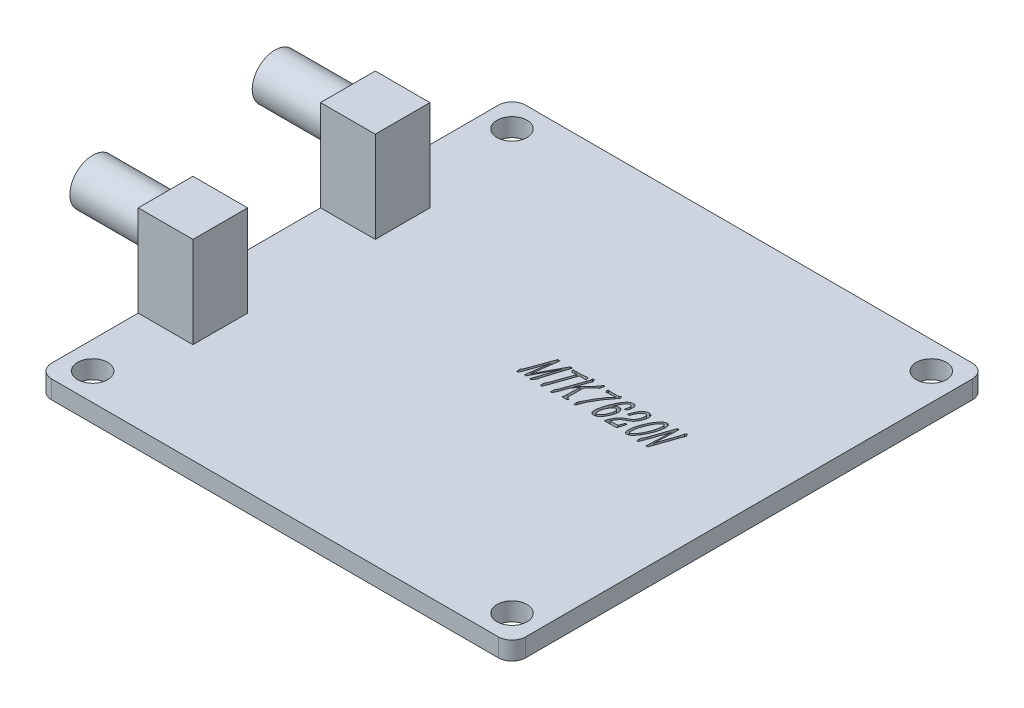
from build123d import *

# Parameters (mm, degrees)
SKETCH_1_R          = 1.65
EXTRUDE_1_DEPTH     = 2
CUT_EXTRUDE_START   = -1
CUT_EXTRUDE_1_DEPTH = 1
SKETCH_3_W          = 6
SKETCH_3_H          = 6
EXTRUDE_2_DEPTH     = 10
SKETCH_4_R          = 2.5
EXTRUDE_3_DEPTH     = 8


# Read off the part's stored shape, not the designer's step: 切除-拉伸1
with BuildPart() as part:
    # 草图1 → 凸台-拉伸1 (new body)
    with BuildSketch(Plane(origin=(0, 0, 0), x_dir=(1, 0, 0), z_dir=(0, 1, 0))):
        with BuildLine():
            Line((24.5, -26), (-24.5, -26))
            ThreePointArc((-24.5, -26), (-25.560660172, -25.560660172), (-26, -24.5))
            Line((-26, -24.5), (-26, 24.5))
            ThreePointArc((-26, 24.5), (-25.560660172, 25.560660172), (-24.5, 26))
            Line((-24.5, 26), (24.5, 26))
            ThreePointArc((24.5, 26), (25.560660172, 25.560660172), (26, 24.5))
            Line((26, 24.5), (26, -24.5))
            ThreePointArc((26, -24.5), (25.560660172, -25.560660172), (24.5, -26))
        make_face()
        with Locations(Location((-23, 23, 0), (0, 0, 270))):
            Circle(SKETCH_1_R, mode=Mode.SUBTRACT)
        with Locations(Location((23, 23, 0), (0, 0, 90))):
            Circle(SKETCH_1_R, mode=Mode.SUBTRACT)
        with Locations(Location((-23, -23, 0), (0, 0, 90))):
            Circle(SKETCH_1_R, mode=Mode.SUBTRACT)
        with Locations(Location((23, -23, 0), (0, 0, 270))):
            Circle(SKETCH_1_R, mode=Mode.SUBTRACT)
    extrude(amount=EXTRUDE_1_DEPTH)

    # 切除-拉伸1 outline → 切除-拉伸1 (cut)
    # profile 1 of 8: a face of its own
    with BuildSketch(Plane(origin=(0, 2, 0), x_dir=(1, 0, 0), z_dir=(0, 1, 0)).offset(CUT_EXTRUDE_START)):
        with BuildLine():
            add(Edge.make_bspline(
                [(2.232154272, 1.011293416), (2.227540815, 0.998411394), (2.218976214, 0.974496709), (2.209064178, 0.940605878), (2.199435252, 0.912364054), (2.191731413, 0.881013608), (2.185728639, 0.845126386), (2.180165157, 0.804614334), (2.17867756, 0.766926656), (2.18024684, 0.734019354), (2.183350071, 0.705928575), (2.183374478, 0.681837677), (2.172770566, 0.65791386), (2.154886953, 0.628493151), (2.127376264, 0.586082516), (2.104768227, 0.554268415), (2.091945451, 0.536224164)],
                knots=[0, 0, 0, 0, 0.080753431, 0.149913804, 0.20839393, 0.25679974, 0.340280675, 0.42310116, 0.498002039, 0.562639444, 0.617115751, 0.66563266, 0.701877649, 0.769590465, 0.869316836, 1, 1, 1, 1], degree=3))
            Line((2.232154272, 1.011293416), (2.301512892, 1.229064564))
            Line((2.301512892, 1.229064564), (3.050287662, 3.593969742))
            Line((3.050287662, 3.593969742), (2.804922225, 3.593969742))
            Line((2.804922225, 3.593969742), (1.287982101, 0.797251225))
            Line((1.287982101, 0.797251225), (1.672810569, 3.593969742))
            Line((1.672810569, 3.593969742), (1.423716173, 3.593969742))
            Line((1.423716173, 3.593969742), (0.560089495, 1.20370765))
            add(Edge.make_bspline(
                [(0.272213936, 0.566055828), (0.27409731, 0.581109529), (0.277792716, 0.610646704), (0.294162379, 0.653578281), (0.318048076, 0.696107861), (0.348164727, 0.736707605), (0.373619365, 0.773152741), (0.393785138, 0.796774711), (0.403682463, 0.815674908), (0.413957842, 0.833170877), (0.423465977, 0.858589935), (0.436626196, 0.887240928), (0.447811248, 0.917106232), (0.459447685, 0.942058714), (0.46745311, 0.961643085), (0.473464246, 0.975295176), (0.479086979, 0.986958971), (0.483591552, 1.001370544), (0.492766441, 1.020673065), (0.501601802, 1.046375699), (0.513117106, 1.077755243), (0.527308709, 1.114356101), (0.542869419, 1.157244706), (0.554103428, 1.187556135), (0.560089495, 1.20370765)],
                knots=[0, 0, 0, 0, 0.064362733, 0.126287432, 0.194015174, 0.271510944, 0.341137925, 0.383462597, 0.40288704, 0.431768008, 0.469698212, 0.518048477, 0.565991795, 0.60531333, 0.635185225, 0.656027709, 0.668812983, 0.690238215, 0.72011011, 0.759616287, 0.805811297, 0.862408184, 0.926683881, 1, 1, 1, 1], degree=3))
            Line((0.272213936, 0.566055828), (0.284146601, 0.348284679))
            add(Edge.make_bspline(
                [(0.330385681, 0.198380567), (0.324328283, 0.199225064), (0.311143825, 0.201063186), (0.295355682, 0.211024146), (0.286852067, 0.226009088), (0.282546334, 0.242607416), (0.280767995, 0.263963083), (0.28077226, 0.288405989), (0.282850781, 0.311719688), (0.282995494, 0.330155913), (0.284222271, 0.341561625), (0.284163396, 0.346792507), (0.284146601, 0.348284679)],
                knots=[0, 0, 0, 0, 0.103457675, 0.225184737, 0.299006802, 0.391175757, 0.514212532, 0.661916962, 0.805649294, 0.911236827, 0.974679241, 1, 1, 1, 1], degree=3))
            add(Edge.make_bspline(
                [(0.53920733, 0.401981675), (0.529908782, 0.378448997), (0.510794992, 0.330075993), (0.480593337, 0.272172839), (0.447684759, 0.230566669), (0.414261894, 0.209155613), (0.374156185, 0.197425234), (0.345631365, 0.198047815), (0.330385681, 0.198380567)],
                knots=[0, 0, 0, 0, 0.238225779, 0.489689114, 0.612577651, 0.732692637, 0.85713202, 1, 1, 1, 1], degree=3))
            Line((0.53920733, 0.401981675), (0.654059237, 0.707756233))
            Line((0.654059237, 0.707756233), (1.405817175, 2.796718517))
            Line((1.405817175, 2.796718517), (1.024717665, 0.322927765))
            Line((1.024717665, 0.322927765), (1.238014063, 0.31621564))
            Line((1.238014063, 0.31621564), (2.545386746, 2.826550181))
            Line((2.545386746, 2.826550181), (1.864479011, 0.733113147))
            Line((1.864479011, 0.733113147), (1.768271894, 0.427338589))
            add(Edge.make_bspline(
                [(1.717558065, 0.252077562), (1.7166954, 0.259799804), (1.714416729, 0.280197582), (1.724508183, 0.317902753), (1.742753226, 0.368247272), (1.759070895, 0.406032651), (1.768271894, 0.427338589)],
                knots=[0, 0, 0, 0, 0.125565402, 0.331672527, 0.62315202, 1, 1, 1, 1], degree=3))
            add(Edge.make_bspline(
                [(1.978585127, 0.367675261), (1.967074159, 0.352371298), (1.94570541, 0.323961301), (1.913841208, 0.286856075), (1.885730179, 0.257719643), (1.853151043, 0.232438728), (1.812850107, 0.213403669), (1.771434856, 0.211295154), (1.743782575, 0.218107417), (1.72784141, 0.225191195), (1.718360869, 0.237650105), (1.717828641, 0.24721496), (1.717558065, 0.252077562)],
                knots=[0, 0, 0, 0, 0.167159473, 0.310311779, 0.426966479, 0.519877317, 0.66953105, 0.808609623, 0.871260354, 0.917867672, 0.958245383, 1, 1, 1, 1], degree=3))
            Line((1.978585127, 0.367675261), (2.091945451, 0.536224164))
        make_face()
    # profile 2 of 8: a face of its own
    with BuildSketch(Plane(origin=(0, 2, 0), x_dir=(1, 0, 0), z_dir=(0, 1, 0)).offset(CUT_EXTRUDE_START)):
        with BuildLine():
            add(Edge.make_bspline(
                [(10.437353505, 2.1941189), (10.446026344, 2.224704013), (10.462189079, 2.281702542), (10.485152093, 2.361132264), (10.506037645, 2.42793498), (10.530531536, 2.503501881), (10.565128451, 2.594316086), (10.595245953, 2.666295228), (10.611122949, 2.704240358)],
                knots=[0, 0, 0, 0, 0.176806308, 0.329496897, 0.459810584, 0.566052454, 0.77123656, 1, 1, 1, 1], degree=3))
            Line((10.437353505, 2.1941189), (10.612614532, 2.217984232))
            Line((10.612614532, 2.217984232), (10.667057319, 2.241103772))
            Line((10.667057319, 2.241103772), (10.726720648, 2.402194758))
            add(Edge.make_bspline(
                [(11.42030684, 3.241210313), (11.400981482, 3.240757185), (11.358546289, 3.239762191), (11.292894873, 3.21333138), (11.221614317, 3.170582731), (11.146340961, 3.109611004), (11.069477899, 3.032289377), (10.996608177, 2.936860027), (10.925400318, 2.824648378), (10.85501324, 2.696335254), (10.786863893, 2.554061095), (10.747004503, 2.453413057), (10.726720648, 2.402194758)],
                knots=[0, 0, 0, 0, 0.050563255, 0.111028292, 0.18322451, 0.269416453, 0.365243966, 0.469747148, 0.584883573, 0.714985691, 0.85496043, 1, 1, 1, 1], degree=3))
            add(Edge.make_bspline(
                [(11.618687407, 2.843703388), (11.621362482, 2.870021391), (11.626476726, 2.920336507), (11.626930184, 2.99333408), (11.619162222, 3.059541133), (11.60698924, 3.11918998), (11.584267821, 3.172021345), (11.541983264, 3.210604938), (11.485679085, 3.234856875), (11.443198161, 3.238985537), (11.42030684, 3.241210313)],
                knots=[0, 0, 0, 0, 0.154058382, 0.294530913, 0.424229108, 0.541566664, 0.649092709, 0.752563447, 0.866666044, 1, 1, 1, 1], degree=3))
            add(Edge.make_bspline(
                [(11.037715747, 1.891327509), (11.056501812, 1.901021344), (11.092648266, 1.919673349), (11.142415445, 1.950516435), (11.187181456, 1.980772805), (11.226841996, 2.014571505), (11.265966668, 2.053553536), (11.306006158, 2.102337589), (11.347976119, 2.162612276), (11.40891101, 2.254276533), (11.478448462, 2.376167772), (11.543353536, 2.528763989), (11.591845474, 2.683894653), (11.609706104, 2.790231434), (11.618687407, 2.843703388)],
                knots=[0, 0, 0, 0, 0.05476668, 0.105377116, 0.151669174, 0.194650271, 0.240210143, 0.294657526, 0.357948043, 0.430501334, 0.579948825, 0.72081211, 0.859609046, 1, 1, 1, 1], degree=3))
            Line((11.037715747, 1.891327509), (10.791604517, 1.763051353))
            add(Edge.make_bspline(
                [(9.945131046, 0.838269763), (9.972038892, 0.893321497), (10.022825885, 0.99722844), (10.104763407, 1.13827915), (10.184701816, 1.256681798), (10.265184953, 1.351995827), (10.342715012, 1.429631638), (10.413551946, 1.497370541), (10.479464321, 1.554686162), (10.561071679, 1.617984485), (10.663789163, 1.687597609), (10.748570642, 1.737646995), (10.791604517, 1.763051353)],
                knots=[0, 0, 0, 0, 0.143839333, 0.271488367, 0.382722806, 0.478837322, 0.563869028, 0.640256739, 0.708952998, 0.768852387, 0.882672751, 1, 1, 1, 1], degree=3))
            add(Edge.make_bspline(
                [(9.888450884, 0.331131472), (9.877464085, 0.330771559), (9.857630179, 0.330121826), (9.830619446, 0.337515829), (9.810068266, 0.352157542), (9.798900603, 0.376235534), (9.797432968, 0.407793192), (9.801403566, 0.448523238), (9.814558223, 0.499146405), (9.84009596, 0.582842534), (9.88447308, 0.697211517), (9.924450023, 0.790176677), (9.945131046, 0.838269763)],
                knots=[0, 0, 0, 0, 0.055062309, 0.09940116, 0.138686278, 0.177851686, 0.228145004, 0.295993015, 0.383390618, 0.490642207, 0.736497112, 1, 1, 1, 1], degree=3))
            Line((9.888450884, 0.331131472), (10.874387385, 0.355742595))
            add(Edge.make_bspline(
                [(11.183890901, 0.553377371), (11.179880521, 0.539966515), (11.172896474, 0.516611612), (11.164120183, 0.485792342), (11.156772207, 0.465080135), (11.150081852, 0.446252079), (11.132172025, 0.425065122), (11.111851659, 0.396911338), (11.074784794, 0.373587741), (11.02434432, 0.364690038), (10.956268033, 0.35589756), (10.903788393, 0.355798239), (10.874387385, 0.355742595)],
                knots=[0, 0, 0, 0, 0.100483591, 0.174991401, 0.22972114, 0.258544779, 0.317448375, 0.426207677, 0.506394728, 0.62409379, 0.789403632, 1, 1, 1, 1], degree=3))
            Line((11.183890901, 0.553377371), (11.399424675, 1.251438312))
            Line((11.399424675, 1.251438312), (11.192094609, 1.251438312))
            Line((11.192094609, 1.251438312), (11.010121457, 0.786064351))
            add(Edge.make_bspline(
                [(10.931067547, 0.642872363), (10.933882441, 0.643394819), (10.939166161, 0.6443755), (10.947123435, 0.650370967), (10.953033056, 0.666113687), (10.966712564, 0.691825755), (10.98654022, 0.733654665), (11.001499502, 0.766901914), (11.010121457, 0.786064351)],
                knots=[0, 0, 0, 0, 0.050886524, 0.095516957, 0.171388695, 0.345046395, 0.622509892, 1, 1, 1, 1], degree=3))
            Line((10.931067547, 0.642872363), (10.134562114, 0.614532282))
            Line((10.134562114, 0.614532282), (10.198700192, 0.772640102))
            add(Edge.make_bspline(
                [(10.834114639, 1.508736416), (10.80478159, 1.492742657), (10.745651012, 1.460501882), (10.661470353, 1.40457342), (10.581018143, 1.34381028), (10.510570769, 1.273672462), (10.44714398, 1.198981821), (10.387001057, 1.120471794), (10.330779509, 1.03414168), (10.278235775, 0.943454614), (10.232002945, 0.85614754), (10.208984723, 0.798428807), (10.198700192, 0.772640102)],
                knots=[0, 0, 0, 0, 0.100736605, 0.203068347, 0.304619499, 0.404315168, 0.502166149, 0.60010617, 0.702437912, 0.812664409, 0.91629854, 1, 1, 1, 1], degree=3))
            Line((10.834114639, 1.508736416), (11.142872363, 1.668335819))
            add(Edge.make_bspline(
                [(11.732793522, 2.308970808), (11.70992826, 2.265279153), (11.663006964, 2.175620482), (11.578653927, 2.049790865), (11.488162457, 1.933450682), (11.405524682, 1.848915338), (11.333665694, 1.792483145), (11.276005971, 1.750233432), (11.211843083, 1.7087072), (11.166348292, 1.68207724), (11.142872363, 1.668335819)],
                knots=[0, 0, 0, 0, 0.166927441, 0.34254808, 0.512188802, 0.665802747, 0.741285181, 0.821454804, 0.907868257, 1, 1, 1, 1], degree=3))
            add(Edge.make_bspline(
                [(11.51800554, 3.538781163), (11.540208987, 3.537117835), (11.58276574, 3.533929778), (11.643386936, 3.520095975), (11.698343083, 3.500313212), (11.746838835, 3.473041702), (11.789608107, 3.441647552), (11.826430185, 3.406681898), (11.856679647, 3.367773107), (11.881774991, 3.325862973), (11.900254703, 3.278828985), (11.91559691, 3.227832865), (11.923675869, 3.171067425), (11.930833425, 3.090010012), (11.928385267, 2.984777885), (11.910280445, 2.856561809), (11.878846994, 2.722605303), (11.838031171, 2.582902167), (11.791137983, 2.44222348), (11.751839228, 2.352469217), (11.732793522, 2.308970808)],
                knots=[0, 0, 0, 0, 0.044636197, 0.085553007, 0.124390622, 0.161466956, 0.196796398, 0.230676006, 0.263017811, 0.295451868, 0.328347086, 0.364194254, 0.402094164, 0.443159791, 0.527501624, 0.612607545, 0.702668551, 0.803424088, 0.90473166, 1, 1, 1, 1], degree=3))
            add(Edge.make_bspline(
                [(10.611122949, 2.704240358), (10.623431556, 2.733376157), (10.64734111, 2.789972648), (10.684014911, 2.871250639), (10.722726581, 2.945167471), (10.761032711, 3.015645801), (10.806582137, 3.083425056), (10.859904041, 3.153346275), (10.923755985, 3.226019045), (10.994102558, 3.300468462), (11.068323555, 3.37039397), (11.144529341, 3.427121407), (11.218504117, 3.471287233), (11.2915945, 3.498431741), (11.359198981, 3.514994961), (11.418862435, 3.529354022), (11.471052865, 3.537226083), (11.503318784, 3.538294735), (11.51800554, 3.538781163)],
                knots=[0, 0, 0, 0, 0.072714776, 0.141248954, 0.204893109, 0.264509684, 0.325534037, 0.392401429, 0.466539591, 0.547790467, 0.627869174, 0.700563736, 0.765849414, 0.825180425, 0.878964782, 0.925827397, 0.966238217, 1, 1, 1, 1], degree=3))
        make_face()
    # profile 3 of 8: a face of its own
    with BuildSketch(Plane(origin=(0, 2, 0), x_dir=(1, 0, 0), z_dir=(0, 1, 0)).offset(CUT_EXTRUDE_START)):
        with BuildLine():
            add(Edge.make_bspline(
                [(12.240677605, 0.281909227), (12.225555712, 0.283605988), (12.194732457, 0.287064531), (12.151181965, 0.307557413), (12.108361685, 0.335460175), (12.067679498, 0.374854333), (12.031499106, 0.427113873), (12.00337103, 0.493843191), (11.983236618, 0.574308928), (11.970445709, 0.667588663), (11.965370115, 0.770822987), (11.964901142, 0.881148501), (11.972934287, 0.997160658), (11.991821752, 1.15735978), (12.027866943, 1.355495343), (12.079235735, 1.546479776), (12.12509233, 1.69036823), (12.15797235, 1.790950136), (12.189076731, 1.885491807), (12.209801044, 1.946284433), (12.21979544, 1.97560196)],
                knots=[0, 0, 0, 0, 0.024470411, 0.049878525, 0.07688002, 0.107038439, 0.140852434, 0.179044671, 0.223539229, 0.274742525, 0.331155154, 0.390694235, 0.45317899, 0.519196415, 0.651682176, 0.778634178, 0.838942965, 0.896064049, 0.949876403, 1, 1, 1, 1], degree=3))
            add(Edge.make_bspline(
                [(13.559982953, 1.864479011), (13.532349511, 1.797409021), (13.475941669, 1.660499786), (13.397385497, 1.490522996), (13.328737601, 1.35125107), (13.271096754, 1.243908781), (13.208467459, 1.134064169), (13.117903418, 0.986483348), (12.996333173, 0.807804108), (12.86455503, 0.641069456), (12.755488962, 0.521788787), (12.67378593, 0.448538226), (12.594017226, 0.388020195), (12.513983237, 0.344387616), (12.437849728, 0.313089996), (12.367275483, 0.29161974), (12.301970305, 0.279869545), (12.260351497, 0.281254524), (12.240677605, 0.281909227)],
                knots=[0, 0, 0, 0, 0.10085837, 0.205881084, 0.260297513, 0.316744586, 0.375270283, 0.43609767, 0.557481045, 0.675547871, 0.73131235, 0.78198088, 0.827957236, 0.870194962, 0.908326141, 0.942230704, 0.972691508, 1, 1, 1, 1], degree=3))
            add(Edge.make_bspline(
                [(13.490624334, 3.558171745), (13.509939195, 3.554875056), (13.547998376, 3.548379059), (13.602116603, 3.526718805), (13.651643016, 3.495704969), (13.697132076, 3.455719487), (13.737078238, 3.404906534), (13.766519156, 3.340531099), (13.787149682, 3.264192109), (13.801173819, 3.145960021), (13.806193104, 2.988991645), (13.795687453, 2.828330454), (13.77886633, 2.695188766), (13.760070346, 2.587217283), (13.735054468, 2.47144543), (13.695596837, 2.308421025), (13.639732676, 2.104146009), (13.586297755, 1.943561287), (13.559982953, 1.864479011)],
                knots=[0, 0, 0, 0, 0.031229977, 0.061537453, 0.092391519, 0.124181989, 0.157860807, 0.194806212, 0.236426189, 0.283712989, 0.384640134, 0.486892873, 0.540531017, 0.598960327, 0.661890621, 0.729696255, 0.866884999, 1, 1, 1, 1], degree=3))
            add(Edge.make_bspline(
                [(12.21979544, 1.97560196), (12.238855402, 2.023967312), (12.2781202, 2.123603176), (12.345074883, 2.274356786), (12.41814873, 2.432243203), (12.498028309, 2.594259772), (12.584698956, 2.75473921), (12.67984981, 2.907101091), (12.781885099, 3.048766218), (12.872526882, 3.158218866), (12.945038353, 3.23931), (12.997634942, 3.292942945), (13.046865018, 3.341419174), (13.092603706, 3.385073884), (13.136748343, 3.421561824), (13.177948965, 3.452230559), (13.215697521, 3.477967098), (13.261684324, 3.503277533), (13.316079836, 3.526102554), (13.377664958, 3.546989772), (13.435752536, 3.558329301), (13.472934311, 3.558222539), (13.490624334, 3.558171745)],
                knots=[0, 0, 0, 0, 0.073657242, 0.151738852, 0.23369364, 0.320183581, 0.40767494, 0.492027186, 0.574543325, 0.654873965, 0.69328591, 0.728660531, 0.761292579, 0.791200262, 0.81821731, 0.842383119, 0.863975273, 0.882896456, 0.916662942, 0.947409455, 0.974978925, 1, 1, 1, 1], degree=3))
        make_face()
        with BuildLine():
            add(Edge.make_bspline(
                [(13.38173876, 3.28595781), (13.376973481, 3.285382342), (13.36484251, 3.283917376), (13.344211367, 3.275208965), (13.316638087, 3.263654124), (13.289668645, 3.249958858), (13.264252179, 3.234463992), (13.241420244, 3.217390037), (13.216339401, 3.194840617), (13.188489021, 3.167467315), (13.157211335, 3.135572911), (13.123202209, 3.098457586), (13.086511251, 3.0563421), (13.032435259, 2.99248986), (12.96363035, 2.901595059), (12.881787119, 2.77947336), (12.802119557, 2.640691222), (12.724882189, 2.491093296), (12.653423638, 2.341360166), (12.587650358, 2.202648357), (12.533369647, 2.078012374), (12.501090444, 1.999515786), (12.486043043, 1.962923503)],
                knots=[0, 0, 0, 0, 0.008781483, 0.022355023, 0.040758238, 0.063829824, 0.077767006, 0.095389206, 0.116089598, 0.139657211, 0.167098278, 0.198115286, 0.232085968, 0.269671248, 0.351757392, 0.441276383, 0.539466961, 0.645441357, 0.75039207, 0.844135978, 0.927341806, 1, 1, 1, 1], degree=3))
            add(Edge.make_bspline(
                [(13.428723631, 2.311953974), (13.437318547, 2.34672302), (13.453976146, 2.414108071), (13.475771709, 2.512255885), (13.492793738, 2.604101898), (13.510907422, 2.716409857), (13.5241713, 2.849791398), (13.52532168, 2.97856894), (13.51841665, 3.073135249), (13.507194692, 3.132296), (13.492796758, 3.181484947), (13.470327604, 3.218460004), (13.447012411, 3.246037996), (13.425115938, 3.266935732), (13.40387954, 3.281654724), (13.388606897, 3.284622979), (13.38173876, 3.28595781)],
                knots=[0, 0, 0, 0, 0.103516914, 0.200623642, 0.290533566, 0.373459734, 0.529392042, 0.677409119, 0.745194257, 0.80297157, 0.851369175, 0.89228073, 0.926963793, 0.955433914, 0.979958543, 1, 1, 1, 1], degree=3))
            add(Edge.make_bspline(
                [(12.351800554, 0.554123162), (12.359797669, 0.554313061), (12.377836969, 0.55474142), (12.407117754, 0.563356961), (12.441603773, 0.576901554), (12.481913783, 0.597562221), (12.528528453, 0.627947171), (12.579122177, 0.672763289), (12.636207308, 0.73021107), (12.720813947, 0.825242039), (12.825188496, 0.960636423), (12.937946976, 1.139709019), (13.042519914, 1.329473541), (13.137731769, 1.525317304), (13.223865668, 1.716623868), (13.285827495, 1.872651472), (13.330874055, 1.995767738), (13.363407933, 2.094093214), (13.396239469, 2.200333684), (13.41764504, 2.273886329), (13.428723631, 2.311953974)],
                knots=[0, 0, 0, 0, 0.011249625, 0.025376074, 0.042707583, 0.063577485, 0.089171482, 0.121025028, 0.158736204, 0.203463039, 0.300521778, 0.399605288, 0.501842896, 0.606192403, 0.706868984, 0.797889509, 0.843064123, 0.891883717, 0.944043722, 1, 1, 1, 1], degree=3))
            add(Edge.make_bspline(
                [(12.486043043, 1.962923503), (12.477207715, 1.939853047), (12.458305709, 1.890496879), (12.431202077, 1.810995377), (12.402221304, 1.721880342), (12.359964976, 1.591397251), (12.313849708, 1.420657578), (12.279444428, 1.247227595), (12.260175156, 1.110760759), (12.251333989, 1.013170657), (12.246782872, 0.920122809), (12.246230228, 0.833445693), (12.251538621, 0.75652212), (12.259272146, 0.692526073), (12.272828324, 0.64330967), (12.290681716, 0.607665041), (12.311517959, 0.585381169), (12.327426845, 0.569110296), (12.340059154, 0.557930001), (12.348480489, 0.555199605), (12.351800554, 0.554123162)],
                knots=[0, 0, 0, 0, 0.050247184, 0.107497159, 0.170820802, 0.240866267, 0.38646782, 0.530264265, 0.600203786, 0.666723591, 0.72949974, 0.78967419, 0.842887151, 0.886295118, 0.920538937, 0.946327987, 0.966402419, 0.982135104, 0.992956865, 1, 1, 1, 1], degree=3))
        make_face(mode=Mode.SUBTRACT)
    # profile 4 of 8: a face of its own
    with BuildSketch(Plane(origin=(0, 2, 0), x_dir=(1, 0, 0), z_dir=(0, 1, 0)).offset(CUT_EXTRUDE_START)):
        with BuildLine():
            add(Edge.make_bspline(
                [(15.789154059, 3.325484765), (15.77636127, 3.305505397), (15.754011433, 3.27060014), (15.725723755, 3.229730987), (15.705562083, 3.199323449), (15.691135402, 3.171263752), (15.673663514, 3.137335182), (15.657044019, 3.097912315), (15.640714815, 3.058354515), (15.62642256, 3.022007357), (15.614323759, 2.991076524), (15.607861437, 2.971754454), (15.604943533, 2.963030045)],
                knots=[0, 0, 0, 0, 0.174245969, 0.304419059, 0.365206869, 0.44201559, 0.535935887, 0.64552267, 0.756078998, 0.850353712, 0.932430868, 1, 1, 1, 1], degree=3))
            Line((15.789154059, 3.325484765), (15.610909866, 3.633496697))
            Line((15.610909866, 3.633496697), (15.46398892, 3.541018538))
            Line((15.46398892, 3.541018538), (15.53409333, 3.534306414))
            Line((15.53409333, 3.534306414), (15.455785212, 3.457489879))
            add(Edge.make_bspline(
                [(15.326017473, 2.957809504), (15.339510991, 2.997234519), (15.366098696, 3.0749178), (15.394162498, 3.171635053), (15.413973187, 3.243955784), (15.426991679, 3.289482099), (15.435834434, 3.327434397), (15.444789147, 3.366549045), (15.452959124, 3.408938114), (15.454871392, 3.44179058), (15.455785212, 3.457489879)],
                knots=[0, 0, 0, 0, 0.241525814, 0.475903866, 0.583590149, 0.676234808, 0.750334843, 0.809419067, 0.908926566, 1, 1, 1, 1], degree=3))
            Line((15.326017473, 2.957809504), (14.627956531, 0.940443213))
            Line((14.627956531, 0.940443213), (14.745045813, 3.598444492))
            Line((14.745045813, 3.598444492), (14.545173663, 3.598444492))
            Line((14.545173663, 3.598444492), (13.700191775, 1.159705945))
            add(Edge.make_bspline(
                [(13.447368421, 0.563818453), (13.447328427, 0.581529996), (13.447257722, 0.61284261), (13.457854072, 0.657478806), (13.479398786, 0.698132263), (13.502804514, 0.734845656), (13.525424816, 0.77135103), (13.545872491, 0.806755684), (13.56756705, 0.849273824), (13.593554734, 0.897670004), (13.62022117, 0.9532755), (13.6467207, 1.016213292), (13.674720814, 1.085264802), (13.691484742, 1.13425887), (13.700191775, 1.159705945)],
                knots=[0, 0, 0, 0, 0.081145371, 0.143458621, 0.208314634, 0.291350129, 0.343639965, 0.40553331, 0.479084513, 0.562846998, 0.657842378, 0.762197388, 0.876487478, 1, 1, 1, 1], degree=3))
            Line((13.447368421, 0.563818453), (13.449605796, 0.342318346))
            add(Edge.make_bspline(
                [(13.81429789, 0.689857234), (13.808652711, 0.67392019), (13.79562352, 0.637137157), (13.771698905, 0.575837413), (13.741399417, 0.500942075), (13.708805336, 0.417753652), (13.673398805, 0.338539566), (13.636046051, 0.275955793), (13.59872946, 0.233667001), (13.559061298, 0.215123537), (13.52551653, 0.21395451), (13.498844429, 0.217025161), (13.477608091, 0.225464376), (13.459777463, 0.248286743), (13.451169735, 0.288863518), (13.450172232, 0.322957783), (13.449605796, 0.342318346)],
                knots=[0, 0, 0, 0, 0.067323883, 0.155384934, 0.262005818, 0.389032266, 0.511274063, 0.606869619, 0.678973058, 0.73214545, 0.77580438, 0.8108044, 0.839152255, 0.863742105, 0.922625412, 1, 1, 1, 1], degree=3))
            Line((13.81429789, 0.689857234), (14.57649691, 2.890688259))
            Line((14.57649691, 2.890688259), (14.458661837, 0.242382271))
            Line((14.458661837, 0.242382271), (14.663008736, 0.242382271))
            Line((14.663008736, 0.242382271), (15.604943533, 2.963030045))
        make_face()
    # profile 5 of 8: a face of its own
    with BuildSketch(Plane(origin=(0, 2, 0), x_dir=(1, 0, 0), z_dir=(0, 1, 0)).offset(CUT_EXTRUDE_START)):
        with BuildLine():
            add(Edge.make_bspline(
                [(5.874600469, 2.964521628), (5.88108846, 2.970960985), (5.898309492, 2.988052929), (5.92918605, 3.020590929), (5.970871355, 3.066615706), (6.021688258, 3.121007956), (6.073359325, 3.178471489), (6.120083674, 3.231283664), (6.157141726, 3.276943979), (6.198120958, 3.328346111), (6.242095948, 3.397177441), (6.273721875, 3.454800437), (6.290752184, 3.48582996)],
                knots=[0, 0, 0, 0, 0.040946767, 0.108684729, 0.200899043, 0.319109171, 0.44211089, 0.54707963, 0.634913368, 0.705528586, 0.841429495, 1, 1, 1, 1], degree=3))
            Line((5.874600469, 2.964521628), (4.916258257, 1.898785425))
            Line((4.916258257, 1.898785425), (5.295120392, 2.992861709))
            add(Edge.make_bspline(
                [(5.486788834, 3.393351801), (5.47957983, 3.382662321), (5.466356982, 3.363055543), (5.448193988, 3.33612722), (5.43433091, 3.314208412), (5.423123464, 3.295692881), (5.413516018, 3.276476352), (5.401220796, 3.253416401), (5.387451879, 3.223624547), (5.363993146, 3.172790037), (5.331057008, 3.095888952), (5.307840875, 3.029330258), (5.295120392, 2.992861709)],
                knots=[0, 0, 0, 0, 0.086791044, 0.159193233, 0.218616471, 0.261378211, 0.304789862, 0.36316717, 0.437270474, 0.525628327, 0.740084347, 1, 1, 1, 1], degree=3))
            Line((5.486788834, 3.393351801), (5.333901556, 3.731941189))
            Line((5.333901556, 3.731941189), (5.185489026, 3.647666738))
            Line((5.185489026, 3.647666738), (5.169827403, 3.544001705))
            add(Edge.make_bspline(
                [(5.046025996, 3.061474537), (5.05052052, 3.074643354), (5.060169762, 3.102915335), (5.075098332, 3.148081661), (5.090617538, 3.199494911), (5.107792721, 3.254100974), (5.124449732, 3.307653378), (5.138056831, 3.355600051), (5.147898173, 3.395387779), (5.155781934, 3.438241716), (5.163645266, 3.486651805), (5.167761515, 3.524837059), (5.169827403, 3.544001705)],
                knots=[0, 0, 0, 0, 0.083581428, 0.179439987, 0.2857121, 0.406147245, 0.523288086, 0.622563275, 0.705501966, 0.769345613, 0.884237786, 1, 1, 1, 1], degree=3))
            Line((5.046025996, 3.061474537), (4.379288302, 1.135094822))
            add(Edge.make_bspline(
                [(4.103345408, 0.435542297), (4.105052189, 0.454684394), (4.108090074, 0.488755242), (4.112428237, 0.532804887), (4.115884984, 0.563411112), (4.120452111, 0.588858458), (4.136334767, 0.615620558), (4.160519562, 0.648403371), (4.187522122, 0.682667151), (4.210272222, 0.718195651), (4.231641218, 0.758093104), (4.25429223, 0.807807382), (4.279935043, 0.863652432), (4.300595224, 0.914010465), (4.317389325, 0.960330509), (4.334742273, 1.007154738), (4.355322971, 1.067014885), (4.370803826, 1.110992399), (4.379288302, 1.135094822)],
                knots=[0, 0, 0, 0, 0.075697189, 0.134732756, 0.174199244, 0.197243181, 0.23577571, 0.294730039, 0.358367838, 0.407251411, 0.460696762, 0.536463564, 0.622351927, 0.702711029, 0.750724084, 0.816385693, 0.899367897, 1, 1, 1, 1], degree=3))
            Line((4.103345408, 0.435542297), (4.086937993, 0.261027062))
            add(Edge.make_bspline(
                [(4.124227573, 0.110377157), (4.120918455, 0.109743379), (4.11197411, 0.108030314), (4.096996094, 0.121934482), (4.086286216, 0.149228129), (4.08268787, 0.188353328), (4.081718223, 0.227394081), (4.085474008, 0.251594047), (4.086937993, 0.261027062)],
                knots=[0, 0, 0, 0, 0.056763927, 0.153429412, 0.317022639, 0.571921784, 0.833137452, 1, 1, 1, 1], degree=3))
            add(Edge.make_bspline(
                [(4.377796719, 0.391540592), (4.368646859, 0.369779468), (4.351219671, 0.32833236), (4.321848008, 0.271462155), (4.289764624, 0.223646244), (4.25522984, 0.18570674), (4.221215134, 0.155480274), (4.187475479, 0.133715097), (4.156134999, 0.116837974), (4.134322851, 0.112421313), (4.124227573, 0.110377157)],
                knots=[0, 0, 0, 0, 0.179628376, 0.342127384, 0.486447582, 0.616396658, 0.73173617, 0.831443756, 0.921987406, 1, 1, 1, 1], degree=3))
            Line((4.377796719, 0.391540592), (4.529938206, 0.783081185))
            Line((4.529938206, 0.783081185), (4.813339016, 1.601960367))
            Line((4.813339016, 1.601960367), (5.2943746, 2.144150863))
            Line((5.2943746, 2.144150863), (5.248135521, 0.812912849))
            add(Edge.make_bspline(
                [(5.197421692, 0.291604517), (5.202105701, 0.320448983), (5.210713917, 0.373459), (5.22323734, 0.447064961), (5.236114272, 0.509764335), (5.241119478, 0.56075995), (5.244261089, 0.608277822), (5.245224142, 0.660773587), (5.246865886, 0.730869955), (5.247681541, 0.78357699), (5.248135521, 0.812912849)],
                knots=[0, 0, 0, 0, 0.166977316, 0.306868932, 0.426682921, 0.532414685, 0.599315494, 0.698793215, 0.832353313, 1, 1, 1, 1], degree=3))
            Line((5.197421692, 0.291604517), (5.752290646, 0.291604517))
            Line((5.752290646, 0.291604517), (5.807479224, 0.450458129))
            Line((5.807479224, 0.450458129), (5.670999361, 0.488493501))
            add(Edge.make_bspline(
                [(5.541977413, 0.912103132), (5.541889757, 0.900169453), (5.541699771, 0.874304272), (5.543389442, 0.832519556), (5.546523153, 0.784544856), (5.550423716, 0.733012334), (5.556627303, 0.683393251), (5.561315308, 0.641019366), (5.56665123, 0.608441895), (5.572714366, 0.57793237), (5.587063379, 0.546591612), (5.614245766, 0.518759474), (5.643011585, 0.498745655), (5.662913762, 0.491455323), (5.670999361, 0.488493501)],
                knots=[0, 0, 0, 0, 0.075733422, 0.164145413, 0.265320339, 0.380886639, 0.492050144, 0.582659213, 0.651396826, 0.701539448, 0.779890147, 0.865861042, 0.945503757, 1, 1, 1, 1], degree=3))
            Line((5.541977413, 0.912103132), (5.553164287, 2.327615598))
            Line((5.553164287, 2.327615598), (6.096100575, 2.884721926))
            add(Edge.make_bspline(
                [(6.442893671, 3.142765821), (6.422386507, 3.132307087), (6.385888068, 3.113692739), (6.343294784, 3.088610869), (6.312807337, 3.067889371), (6.287518188, 3.049126152), (6.257705675, 3.025968174), (6.213446439, 2.990229693), (6.157795672, 2.944042692), (6.11626407, 2.90410943), (6.096100575, 2.884721926)],
                knots=[0, 0, 0, 0, 0.159045705, 0.283067895, 0.341192268, 0.413683836, 0.500611963, 0.602016393, 0.806779906, 1, 1, 1, 1], degree=3))
            Line((6.442893671, 3.142765821), (6.571169827, 3.643191988))
            Line((6.571169827, 3.643191988), (6.378009802, 3.643191988))
            Line((6.378009802, 3.643191988), (6.290752184, 3.48582996))
        make_face()
    # profile 6 of 8: a face of its own
    with BuildSketch(Plane(origin=(0, 2, 0), x_dir=(1, 0, 0), z_dir=(0, 1, 0)).offset(CUT_EXTRUDE_START)):
        with BuildLine():
            add(Edge.make_bspline(
                [(4.245791605, 3.221819732), (4.228636722, 3.222391578), (4.203558192, 3.223227554), (4.178490403, 3.223584909), (4.170565525, 3.223724137)],
                knots=[0, 0, 0, 0, 0.385339327, 0.563323248, 0.563323248, 0.563323248, 0.563323248], degree=3))
            Line((4.245791605, 3.221819732), (4.618687407, 3.226294481))
            Line((4.618687407, 3.226294481), (4.723098231, 3.226294481))
            add(Edge.make_bspline(
                [(4.882697635, 3.371723844), (4.885958062, 3.36304394), (4.891786822, 3.347526626), (4.899283278, 3.326310297), (4.902140514, 3.309519353), (4.903246276, 3.291659098), (4.888547042, 3.270949119), (4.86724785, 3.252798247), (4.839306795, 3.238486838), (4.807610161, 3.232208417), (4.768294081, 3.22660225), (4.739040841, 3.226403045), (4.723098231, 3.226294481)],
                knots=[0, 0, 0, 0, 0.098478381, 0.176052627, 0.237628101, 0.279829758, 0.361297128, 0.490324206, 0.578792117, 0.690103986, 0.83111097, 1, 1, 1, 1], degree=3))
            Line((4.882697635, 3.371723844), (4.776049435, 3.568612828))
            Line((4.776049435, 3.568612828), (4.585872576, 3.521627957))
            add(Edge.make_bspline(
                [(4.230875772, 3.479117835), (4.248547281, 3.480148223), (4.290239118, 3.482579185), (4.357869168, 3.492363962), (4.432607605, 3.501769409), (4.494223484, 3.507212579), (4.537670738, 3.50854334), (4.560853154, 3.513372503), (4.577199708, 3.515065387), (4.583702038, 3.519985557), (4.585872576, 3.521627957)],
                knots=[0, 0, 0, 0, 0.147990506, 0.349149376, 0.571198419, 0.777712566, 0.867336524, 0.932625479, 0.977509755, 1, 1, 1, 1], degree=3))
            Line((4.230875772, 3.479117835), (4.02056254, 3.474643085))
            Line((4.02056254, 3.474643085), (3.761027062, 3.464202003))
            Line((3.761027062, 3.464202003), (3.657362029, 3.464202003))
            add(Edge.make_bspline(
                [(3.586511826, 3.45823567), (3.595454782, 3.459303239), (3.618998046, 3.462113725), (3.642677353, 3.463402668), (3.657362029, 3.464202003)],
                knots=[0, 0, 0, 0, 0.379852017, 1, 1, 1, 1], degree=3))
            Line((3.586511826, 3.45823567), (3.480609418, 3.469422544))
            add(Edge.make_bspline(
                [(3.391860217, 3.467930961), (3.403542197, 3.468526395), (3.433103793, 3.470033157), (3.462705526, 3.469652672), (3.480609418, 3.469422544)],
                knots=[0, 0, 0, 0, 0.395174165, 1, 1, 1, 1], degree=3))
            add(Edge.make_bspline(
                [(3.265821436, 3.322501598), (3.257850124, 3.335877478), (3.24368028, 3.359654508), (3.243855024, 3.400644414), (3.262745846, 3.430495919), (3.282633569, 3.452111592), (3.305851516, 3.464391408), (3.329781497, 3.4684308), (3.359030541, 3.471200947), (3.380174477, 3.469094914), (3.391860217, 3.467930961)],
                knots=[0, 0, 0, 0, 0.179183743, 0.318517909, 0.451004222, 0.582341234, 0.657629915, 0.752695214, 0.863320643, 1, 1, 1, 1], degree=3))
            Line((3.265821436, 3.322501598), (3.399318133, 3.167376944))
            Line((3.399318133, 3.167376944), (3.529831664, 3.182292776))
            add(Edge.make_bspline(
                [(3.884082676, 3.211378649), (3.883090248, 3.211117736), (3.875100964, 3.209017323), (3.85889651, 3.209586529), (3.831645844, 3.207207546), (3.793821066, 3.204307101), (3.741377963, 3.199851492), (3.679764243, 3.194126659), (3.620074625, 3.189475223), (3.573580013, 3.185832715), (3.545497058, 3.183488052), (3.533063586, 3.182539373), (3.529831664, 3.182292776)],
                knots=[0, 0, 0, 0, 0.008649935, 0.069634052, 0.1348047, 0.2400357, 0.389518755, 0.579075778, 0.762184431, 0.894768826, 0.972646504, 1, 1, 1, 1], degree=3))
            Line((3.884082676, 3.211378649), (3.195717025, 1.223844023))
            add(Edge.make_bspline(
                [(2.911570424, 0.510867249), (2.911692491, 0.528523728), (2.911912682, 0.560373337), (2.913838817, 0.602448003), (2.917317389, 0.633721182), (2.9267776, 0.661478162), (2.945775563, 0.688847527), (2.969096435, 0.722668041), (2.995286789, 0.756963294), (3.0166401, 0.794657938), (3.036799386, 0.835456617), (3.05903213, 0.884378707), (3.08692105, 0.946899879), (3.120412272, 1.025888227), (3.158912493, 1.119921947), (3.183087096, 1.18818188), (3.195717025, 1.223844023)],
                knots=[0, 0, 0, 0, 0.068077095, 0.122800754, 0.16252766, 0.188906005, 0.234945361, 0.29000393, 0.347735516, 0.40101233, 0.456751172, 0.52324359, 0.60822579, 0.720770271, 0.854117489, 1, 1, 1, 1], degree=3))
            Line((2.911570424, 0.510867249), (2.910078841, 0.333368847))
            add(Edge.make_bspline(
                [(2.947368421, 0.189431068), (2.944316835, 0.188839596), (2.935638403, 0.187157505), (2.921103901, 0.200902738), (2.910479113, 0.226496855), (2.906322929, 0.263181442), (2.906094425, 0.300154408), (2.908916663, 0.32368083), (2.910078841, 0.333368847)],
                knots=[0, 0, 0, 0, 0.054803173, 0.155855232, 0.32276542, 0.566709069, 0.821573795, 1, 1, 1, 1], degree=3))
            add(Edge.make_bspline(
                [(3.164393778, 0.392286384), (3.154282702, 0.367249783), (3.133144519, 0.31490835), (3.093071344, 0.256319261), (3.055049113, 0.214141989), (3.02100295, 0.194235504), (2.984340371, 0.183753558), (2.959829203, 0.187517557), (2.947368421, 0.189431068)],
                knots=[0, 0, 0, 0, 0.24988735, 0.522413655, 0.654533736, 0.772417042, 0.884303283, 1, 1, 1, 1], degree=3))
            Line((3.164393778, 0.392286384), (3.368740678, 0.909865758))
            Line((3.368740678, 0.909865758), (4.170565525, 3.223724137))
        make_face()
    # profile 7 of 8: a face of its own
    with BuildSketch(Plane(origin=(0, 2, 0), x_dir=(1, 0, 0), z_dir=(0, 1, 0)).offset(CUT_EXTRUDE_START)):
        with BuildLine():
            add(Edge.make_bspline(
                [(9.792243767, 2.529725123), (9.799372132, 2.567830624), (9.812600307, 2.638543373), (9.836428846, 2.738810386), (9.859366058, 2.83309971), (9.875112071, 2.928406503), (9.88140748, 3.024022456), (9.873689404, 3.101456515), (9.857333859, 3.156938358), (9.842423645, 3.194089384), (9.820912552, 3.225207318), (9.795582287, 3.250684221), (9.766915488, 3.270288272), (9.73614343, 3.284015152), (9.702830743, 3.291074833), (9.657303221, 3.290006717), (9.601754452, 3.280496298), (9.548632509, 3.25837237), (9.507025723, 3.229718869), (9.468720458, 3.199008787), (9.425243564, 3.156252878), (9.374141873, 3.105345591), (9.319738183, 3.043543935), (9.265177233, 2.971198575), (9.209533838, 2.889534868), (9.13663865, 2.766635878), (9.048777123, 2.602847504), (8.972390569, 2.433051534), (8.918346767, 2.301323215), (8.894204483, 2.239116022), (8.882964065, 2.210525074)],
                knots=[0, 0, 0, 0, 0.048016888, 0.089105405, 0.127654772, 0.168210064, 0.208611881, 0.246125029, 0.263765638, 0.280183723, 0.295474126, 0.310282398, 0.324462469, 0.338252576, 0.351782306, 0.366256964, 0.394408992, 0.421179489, 0.436725185, 0.456877911, 0.481929832, 0.512200465, 0.546242109, 0.583815889, 0.624389886, 0.668597469, 0.76077153, 0.854490538, 0.899099648, 0.93715592, 0.93715592, 0.93715592, 0.93715592], degree=3))
            Line((9.792243767, 2.529725123), (9.959301087, 2.553590454))
            Line((9.959301087, 2.553590454), (10.015235457, 2.577455785))
            Line((10.015235457, 2.577455785), (10.069678244, 2.735563605))
            add(Edge.make_bspline(
                [(9.773598977, 3.558171745), (9.80555709, 3.55537961), (9.864223018, 3.55025405), (9.943371428, 3.530082967), (10.005684977, 3.499358127), (10.048742789, 3.457009642), (10.077162673, 3.412414193), (10.100897983, 3.371220088), (10.118537235, 3.332653625), (10.129194335, 3.294841352), (10.136541045, 3.255421395), (10.138522857, 3.210409655), (10.139883518, 3.158391127), (10.135898746, 3.101732242), (10.13281299, 3.045264039), (10.128207919, 2.993299452), (10.123286555, 2.948240187), (10.114771829, 2.894323663), (10.099367645, 2.823432882), (10.08028181, 2.766946106), (10.069678244, 2.735563605)],
                knots=[0, 0, 0, 0, 0.091586168, 0.168125935, 0.232336966, 0.287622003, 0.338278218, 0.383145194, 0.423552602, 0.459085297, 0.495189033, 0.537922916, 0.587673765, 0.643887342, 0.700141333, 0.749361491, 0.792995872, 0.829682411, 0.905376226, 1, 1, 1, 1], degree=3))
            add(Edge.make_bspline(
                [(8.551246537, 2.088962284), (8.564662569, 2.124514194), (8.589830803, 2.191208933), (8.625356609, 2.284990134), (8.658282588, 2.365405537), (8.697816363, 2.458460171), (8.751783496, 2.571015442), (8.819148732, 2.7098071), (8.895444573, 2.84851108), (8.961784294, 2.962189864), (9.020273858, 3.05014134), (9.069990229, 3.11763489), (9.126627183, 3.186987801), (9.186822036, 3.258491084), (9.251871147, 3.326433394), (9.318785418, 3.388282473), (9.387831067, 3.440367594), (9.457386231, 3.48551032), (9.53061958, 3.520567517), (9.608012829, 3.544224908), (9.689536232, 3.558489113), (9.745200397, 3.55827896), (9.773598977, 3.558171745)],
                knots=[0, 0, 0, 0, 0.056410835, 0.105825706, 0.14886341, 0.185400755, 0.255897094, 0.334127727, 0.414387224, 0.490842857, 0.529430594, 0.571134342, 0.615225599, 0.662339254, 0.709844425, 0.754777107, 0.797439761, 0.838085033, 0.877703722, 0.91750761, 0.957914275, 1, 1, 1, 1], degree=3))
            add(Edge.make_bspline(
                [(8.692946942, 0.281909227), (8.665117944, 0.280098745), (8.611072946, 0.276582721), (8.543456028, 0.287224422), (8.492918852, 0.307853057), (8.454203755, 0.329435729), (8.415063862, 0.358703245), (8.375424998, 0.393420868), (8.338531464, 0.435175841), (8.310520387, 0.485120934), (8.28713982, 0.539843172), (8.269970538, 0.623039326), (8.258032784, 0.73268396), (8.253416789, 0.847487699), (8.258219618, 0.948152915), (8.269484178, 1.037662616), (8.285820527, 1.140700776), (8.308314285, 1.251967632), (8.333319672, 1.361489032), (8.354071238, 1.45999998), (8.373978906, 1.541057249), (8.394414243, 1.627581379), (8.42265533, 1.724331764), (8.459781299, 1.839703457), (8.503222891, 1.961317245), (8.534710144, 2.045009175), (8.551246537, 2.088962284)],
                knots=[0, 0, 0, 0, 0.03956068, 0.07682838, 0.095843058, 0.116866224, 0.139607214, 0.165118082, 0.191658894, 0.218244295, 0.246111869, 0.275832629, 0.33841793, 0.402715898, 0.438774703, 0.481433334, 0.530775575, 0.586935239, 0.642621152, 0.690341085, 0.729908068, 0.761166336, 0.816603174, 0.872993246, 0.933298924, 1, 1, 1, 1], degree=3))
            add(Edge.make_bspline(
                [(9.540911997, 1.084380993), (9.526491166, 1.05541355), (9.495947832, 0.994060479), (9.442538196, 0.900045656), (9.381766917, 0.797266792), (9.315317635, 0.689580228), (9.243296084, 0.585020153), (9.162531383, 0.496193855), (9.076689827, 0.425272911), (8.987168272, 0.373835141), (8.901028335, 0.337241697), (8.823357848, 0.30914977), (8.755504452, 0.289066112), (8.712433541, 0.284138589), (8.692946942, 0.281909227)],
                knots=[0, 0, 0, 0, 0.079263847, 0.167880907, 0.264814542, 0.371790082, 0.477921398, 0.575347443, 0.664953156, 0.749565857, 0.827301008, 0.893958514, 0.952023584, 1, 1, 1, 1], degree=3))
            add(Edge.make_bspline(
                [(9.339548263, 2.42158534), (9.359207903, 2.42118425), (9.396911622, 2.420415029), (9.450936401, 2.413823439), (9.49974583, 2.402341257), (9.543043293, 2.384465457), (9.582744901, 2.363025804), (9.617869221, 2.334657677), (9.650441033, 2.301762803), (9.678815416, 2.262416031), (9.70345966, 2.217275717), (9.724179457, 2.166182107), (9.741550972, 2.109090825), (9.757744788, 2.024054569), (9.769155849, 1.911174741), (9.761881363, 1.794565371), (9.747253331, 1.697461188), (9.729579313, 1.617881049), (9.706512484, 1.53225165), (9.667456944, 1.411518301), (9.614309627, 1.260480826), (9.565069895, 1.142342016), (9.540911997, 1.084380993)],
                knots=[0, 0, 0, 0, 0.036382012, 0.069774277, 0.100580197, 0.128866596, 0.156266865, 0.183794371, 0.212106964, 0.241746136, 0.273258923, 0.307101626, 0.343643368, 0.383535045, 0.467197852, 0.552918689, 0.598998486, 0.648914818, 0.703726948, 0.763108811, 0.883776925, 1, 1, 1, 1], degree=3))
            add(Edge.make_bspline(
                [(8.882964065, 2.210525074), (8.888668979, 2.215819905), (8.921748517, 2.245792172), (8.988006043, 2.296635031), (9.069563427, 2.34739101), (9.142579811, 2.38141985), (9.203576897, 2.401452348), (9.26998024, 2.414729849), (9.315879391, 2.419252922), (9.339548263, 2.42158534)],
                knots=[0.404971471, 0.404971471, 0.404971471, 0.404971471, 0.432023627, 0.560128766, 0.694717093, 0.765101066, 0.83971451, 0.917345382, 1, 1, 1, 1], degree=3))
        make_face()
        with BuildLine():
            add(Edge.make_bspline(
                [(9.256019604, 2.144150863), (9.245718811, 2.142556458), (9.223237442, 2.139076688), (9.188646151, 2.124014401), (9.149347563, 2.104229335), (9.092126523, 2.068122267), (9.021828337, 2.014286204), (8.958566358, 1.949276583), (8.910844125, 1.889966685), (8.874786853, 1.836055129), (8.834743118, 1.775401551), (8.795118834, 1.70543497), (8.754969253, 1.628120598), (8.71549876, 1.544201096), (8.677989984, 1.453333549), (8.655385878, 1.390009052), (8.643724696, 1.35734072)],
                knots=[0, 0, 0, 0, 0.030109941, 0.065714622, 0.108588335, 0.157792871, 0.261597461, 0.364557771, 0.419941904, 0.482122806, 0.552499195, 0.630638236, 0.715103682, 0.805067532, 0.89943673, 1, 1, 1, 1], degree=3))
            add(Edge.make_bspline(
                [(9.467078628, 1.706371191), (9.468642228, 1.727987763), (9.471713132, 1.770442601), (9.470774021, 1.83301138), (9.465923495, 1.893197713), (9.455428911, 1.949506966), (9.441971483, 2.000724278), (9.424213344, 2.044118522), (9.403508607, 2.079967855), (9.377632355, 2.106412307), (9.349404105, 2.125274258), (9.319768113, 2.138714329), (9.288061691, 2.144403173), (9.266721574, 2.144235134), (9.256019604, 2.144150863)],
                knots=[0, 0, 0, 0, 0.117814531, 0.231387145, 0.339957123, 0.445764662, 0.542521874, 0.627383564, 0.700188791, 0.766158301, 0.826528991, 0.884046869, 0.941850039, 1, 1, 1, 1], degree=3))
            add(Edge.make_bspline(
                [(8.733965481, 0.559343703), (8.749735782, 0.561036132), (8.782669246, 0.564570469), (8.832316107, 0.581371719), (8.883989005, 0.606364875), (8.937006339, 0.639656708), (8.988876969, 0.68049559), (9.039067577, 0.725344467), (9.084141393, 0.776372283), (9.140450463, 0.851112799), (9.203948696, 0.95619793), (9.26855342, 1.094643622), (9.327726266, 1.241413379), (9.388281871, 1.390752272), (9.439926406, 1.545247184), (9.458016251, 1.652594138), (9.467078628, 1.706371191)],
                knots=[0, 0, 0, 0, 0.033065291, 0.069050969, 0.108790502, 0.152905102, 0.19956824, 0.246646067, 0.293375687, 0.341592316, 0.442107469, 0.549241177, 0.660589479, 0.772799957, 0.88618076, 1, 1, 1, 1], degree=3))
            add(Edge.make_bspline(
                [(8.643724696, 1.35734072), (8.629833685, 1.313537581), (8.601565571, 1.22439849), (8.572530533, 1.087160277), (8.555555572, 0.949425392), (8.554336331, 0.837543122), (8.561976266, 0.754881106), (8.571862154, 0.701098577), (8.587665716, 0.655622102), (8.606385371, 0.617106754), (8.631573932, 0.587815623), (8.661517524, 0.567377888), (8.696818415, 0.557126412), (8.721237058, 0.55858395), (8.733965481, 0.559343703)],
                knots=[0, 0, 0, 0, 0.152325287, 0.309980926, 0.464393534, 0.611968529, 0.679892627, 0.739554139, 0.792740957, 0.839202455, 0.880695047, 0.919337794, 0.957954149, 1, 1, 1, 1], degree=3))
        make_face(mode=Mode.SUBTRACT)
    # profile 8 of 8: a face of its own
    with BuildSketch(Plane(origin=(0, 2, 0), x_dir=(1, 0, 0), z_dir=(0, 1, 0)).offset(CUT_EXTRUDE_START)):
        with BuildLine():
            add(Edge.make_bspline(
                [(8.195860442, 3.199148114), (8.171877437, 3.198221556), (8.112596168, 3.195982426), (8.021474526, 3.193039481), (7.926531953, 3.188982815), (7.84248352, 3.186344517), (7.769915964, 3.183020697), (7.708488443, 3.181135381), (7.6585419, 3.178621575), (7.628951997, 3.177543331), (7.616023865, 3.177072235)],
                knots=[0.073329805, 0.073329805, 0.073329805, 0.073329805, 0.188317586, 0.357547946, 0.510115411, 0.643595257, 0.760412892, 0.85814228, 0.938020909, 1, 1, 1, 1], degree=3))
            Line((8.195860442, 3.199148114), (7.947155338, 2.95631792))
            Line((7.947155338, 2.95631792), (7.633922864, 2.539420413))
            add(Edge.make_bspline(
                [(6.659173237, 0.853931387), (6.672711717, 0.878481676), (6.702896229, 0.933217401), (6.749970563, 1.025185683), (6.806469884, 1.133782606), (6.865811955, 1.255391616), (6.925549358, 1.377160253), (6.980348665, 1.487494866), (7.028451577, 1.579904818), (7.070462231, 1.661241155), (7.115377162, 1.740990167), (7.168680362, 1.830542584), (7.232900374, 1.935658412), (7.332420632, 2.095415179), (7.465025735, 2.300047799), (7.578217443, 2.460470864), (7.633922864, 2.539420413)],
                knots=[0, 0, 0, 0, 0.043130864, 0.096161764, 0.158939071, 0.231463031, 0.304330082, 0.367616796, 0.420987275, 0.464612178, 0.508447822, 0.561775801, 0.624943365, 0.697958821, 0.851355446, 1, 1, 1, 1], degree=3))
            Line((6.659173237, 0.853931387), (6.567440869, 0.707756233))
            add(Edge.make_bspline(
                [(6.518218623, 0.62273599), (6.525004169, 0.633632322), (6.536974622, 0.652854656), (6.551533407, 0.678158676), (6.561887712, 0.695236316), (6.565996702, 0.704500273), (6.567440869, 0.707756233)],
                knots=[0, 0, 0, 0, 0.391659888, 0.690931335, 0.891373092, 1, 1, 1, 1], degree=3))
            Line((6.518218623, 0.62273599), (6.569678244, 0.227466439))
            Line((6.569678244, 0.227466439), (6.73524398, 0.280417643))
            Line((6.73524398, 0.280417643), (6.813552099, 0.507884083))
            add(Edge.make_bspline(
                [(8.410291924, 3.174089069), (8.399343861, 3.159926571), (8.379394462, 3.134119877), (8.352310214, 3.098808934), (8.33092187, 3.070533054), (8.315184487, 3.050452792), (8.302241551, 3.034502671), (8.289677742, 3.017810006), (8.272336529, 2.996525029), (8.251703487, 2.96908574), (8.225051172, 2.937792623), (8.196760783, 2.899239165), (8.162712283, 2.856859207), (8.113030522, 2.794383886), (8.050281414, 2.715666659), (7.980992982, 2.621746404), (7.9147242, 2.535265516), (7.835694972, 2.424328808), (7.739341236, 2.28453271), (7.644222363, 2.1404111), (7.566451011, 2.018085007), (7.505101004, 1.920253914), (7.441917837, 1.816853487), (7.354959734, 1.671252496), (7.248056152, 1.481695315), (7.145523603, 1.288577276), (7.069896988, 1.134076959), (7.016732498, 1.024990605), (6.971232275, 0.921595584), (6.929718521, 0.82532908), (6.894320837, 0.735805402), (6.862400663, 0.653813067), (6.836646433, 0.578410575), (6.820964622, 0.53052077), (6.813552099, 0.507884083)],
                knots=[0, 0, 0, 0, 0.017191251, 0.031325642, 0.042738021, 0.051239466, 0.055825595, 0.062463375, 0.071300141, 0.082188559, 0.095425421, 0.110753477, 0.128091643, 0.147629335, 0.187414488, 0.224754134, 0.259706339, 0.292039235, 0.355547924, 0.422757744, 0.457859659, 0.494757055, 0.533655536, 0.574231541, 0.657621356, 0.742629432, 0.784163401, 0.822819347, 0.859156362, 0.892636799, 0.923493063, 0.951604132, 0.977124105, 1, 1, 1, 1], degree=3))
            Line((8.410291924, 3.174089069), (8.573620286, 3.290432559))
            Line((8.573620286, 3.290432559), (8.429682506, 3.593969742))
            Line((8.429682506, 3.593969742), (8.228318773, 3.44406563))
            Line((8.228318773, 3.44406563), (7.809929683, 3.43511613))
            add(Edge.make_bspline(
                [(7.405710633, 3.444811421), (7.444726412, 3.44187062), (7.519223144, 3.436255453), (7.625669183, 3.431464978), (7.721465242, 3.431426346), (7.781594916, 3.433934309), (7.809929683, 3.43511613)],
                knots=[0, 0, 0, 0, 0.290067145, 0.553854226, 0.789763768, 1, 1, 1, 1], degree=3))
            Line((7.405710633, 3.444811421), (7.23716173, 3.454506712))
            Line((7.23716173, 3.454506712), (7.130513531, 3.464947795))
            add(Edge.make_bspline(
                [(7.05593437, 3.347112721), (7.054515544, 3.358746089), (7.051760992, 3.381331469), (7.054335071, 3.410485223), (7.065084204, 3.432084772), (7.081308616, 3.445643885), (7.103658316, 3.456607165), (7.120966522, 3.461982707), (7.130513531, 3.464947795)],
                knots=[0, 0, 0, 0, 0.219392128, 0.425934656, 0.536196231, 0.661344635, 0.813201572, 1, 1, 1, 1], degree=3))
            Line((7.05593437, 3.347112721), (7.122309823, 3.221819732))
            add(Edge.make_bspline(
                [(7.177498402, 3.140528447), (7.172813448, 3.143000985), (7.161985839, 3.148715379), (7.148700564, 3.166371294), (7.134777987, 3.190862783), (7.126771475, 3.210741988), (7.122309823, 3.221819732)],
                knots=[0, 0, 0, 0, 0.156538243, 0.361782571, 0.644351529, 1, 1, 1, 1], degree=3))
            add(Edge.make_bspline(
                [(7.254314937, 3.139782655), (7.23938585, 3.138417538), (7.213724799, 3.136071088), (7.188181232, 3.139214013), (7.177498402, 3.140528447)],
                knots=[0, 0, 0, 0, 0.581780019, 1, 1, 1, 1], degree=3))
            Line((7.254314937, 3.139782655), (7.313978266, 3.159173237))
            add(Edge.make_bspline(
                [(7.374387385, 3.167376944), (7.36181062, 3.167782788), (7.341120775, 3.168450436), (7.321623646, 3.161786397), (7.313978266, 3.159173237)],
                knots=[0, 0, 0, 0, 0.607871461, 1, 1, 1, 1], degree=3))
            Line((7.374387385, 3.167376944), (7.616023865, 3.177072235))
        make_face()
    extrude(amount=CUT_EXTRUDE_1_DEPTH, mode=Mode.SUBTRACT)

    # 草图3 → 凸台-拉伸2 (add)
    with BuildSketch(Plane(origin=(0, 2, 0), x_dir=(1, 0, 0), z_dir=(0, 1, 0))):
        with Locations((-23, 8)):
            Rectangle(SKETCH_3_W, SKETCH_3_H)
        with Locations((-23, -12)):
            Rectangle(SKETCH_3_W, SKETCH_3_H)
    extrude(amount=EXTRUDE_2_DEPTH)

    # 草图4 → 凸台-拉伸3 (add)
    with BuildSketch(Plane.ZY.offset(26)):
        with Locations((-8, 9)):
            Circle(SKETCH_4_R)
        with Locations((12, 9)):
            Circle(SKETCH_4_R)
    extrude(amount=EXTRUDE_3_DEPTH)


solid = part.part
